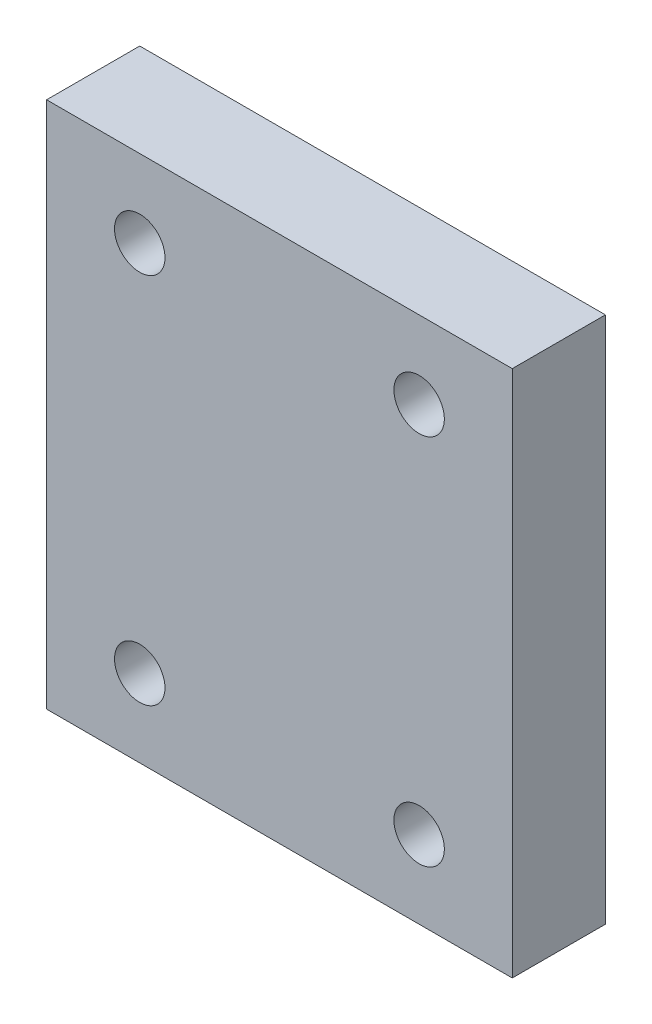
from build123d import *

# Parameters (mm, degrees)
SKETCH1_W           = 30
SKETCH1_H           = 34
SKETCH1_R           = 1.625
BOSS_EXTRUDE1_DEPTH = 6


with BuildPart() as part:
    # Sketch1 → Boss-Extrude1 (new body)
    with BuildSketch(Plane.XY):
        Rectangle(SKETCH1_W, SKETCH1_H)
        with Locations((-9, 12)):
            Circle(SKETCH1_R, mode=Mode.SUBTRACT)
        with Locations((9, 12)):
            Circle(SKETCH1_R, mode=Mode.SUBTRACT)
        with Locations((-9, -12)):
            Circle(SKETCH1_R, mode=Mode.SUBTRACT)
        with Locations((9, -12)):
            Circle(SKETCH1_R, mode=Mode.SUBTRACT)
    extrude(amount=BOSS_EXTRUDE1_DEPTH)


solid = part.part
